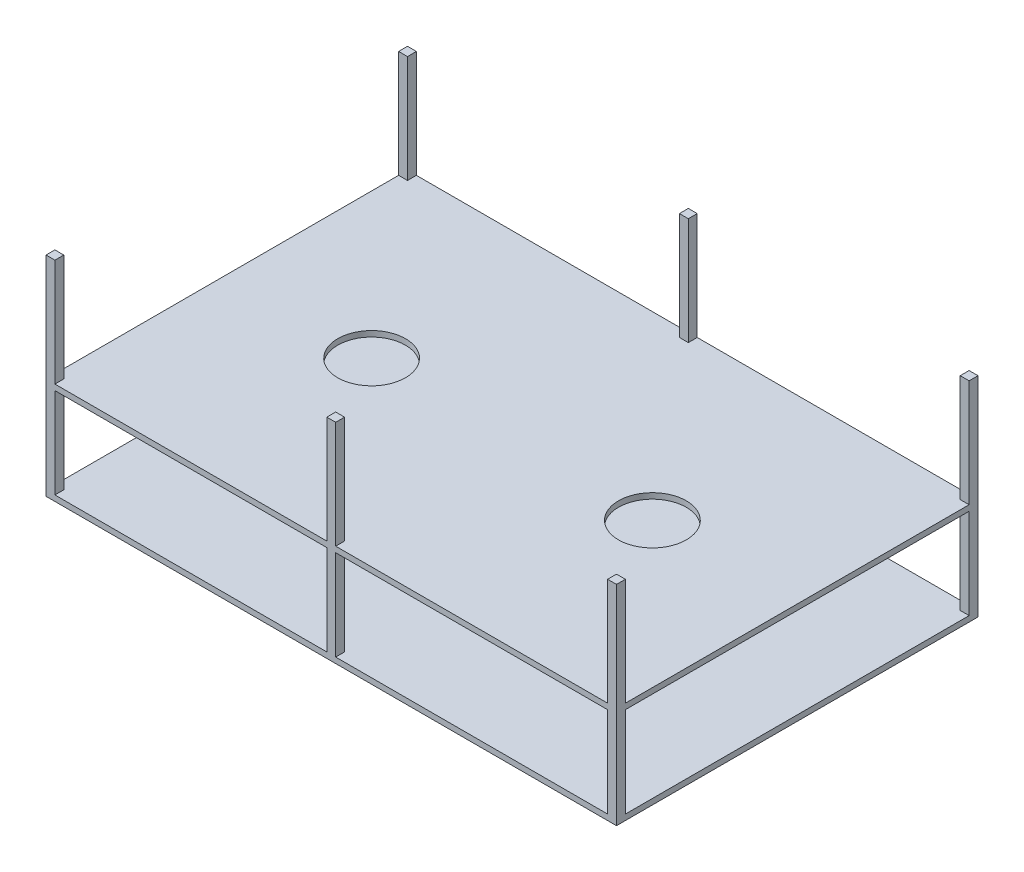
from build123d import *

# Parameters (mm, degrees)
SKETCH1_W             = 40
SKETCH1_H             = 40
BOSS_EXTRUDE1_DEPTH   = 939.8
BOSS_EXTRUDE1_2_DEPTH = 939.8
BOSS_EXTRUDE1_3_DEPTH = 939.8
BOSS_EXTRUDE1_4_DEPTH = 939.8
BOSS_EXTRUDE1_5_DEPTH = 939.8
BOSS_EXTRUDE1_6_DEPTH = 939.8
SKETCH2_W             = 2565.4
SKETCH2_H             = 1625.6
BOSS_EXTRUDE2_DEPTH   = 25.4
SKETCH3_W             = 2565.4
SKETCH3_H             = 1625.6
BOSS_EXTRUDE3_DEPTH   = 25.4
SKETCH4_R             = 152.4
CUT_EXTRUDE1_DEPTH    = 1606.227272334


with BuildPart() as part:
    # Sketch1 → Boss-Extrude1 (new body)
    with BuildSketch(Plane.XZ.offset(-2661.458218508)):
        with Locations((1253.466421536, 801.437438082)):
            Rectangle(SKETCH1_W, SKETCH1_H)
    extrude(amount=BOSS_EXTRUDE1_DEPTH)



with BuildPart() as body_2:
    # Sketch1 → Boss-Extrude1 2 (new body)
    with BuildSketch(Plane.XZ.offset(-2661.458218508)):
        with Locations((-1271.933578464, 801.437438082)):
            Rectangle(SKETCH1_W, SKETCH1_H)
    extrude(amount=BOSS_EXTRUDE1_2_DEPTH)


with BuildPart() as body_3:
    # Sketch1 → Boss-Extrude1 3 (new body)
    with BuildSketch(Plane.XZ.offset(-2661.458218508)):
        with Locations((-9.233578464, 801.437438082)):
            Rectangle(SKETCH1_W, SKETCH1_H)
    extrude(amount=BOSS_EXTRUDE1_3_DEPTH)


with BuildPart() as body_4:
    # Sketch1 → Boss-Extrude1 4 (new body)
    with BuildSketch(Plane.XZ.offset(-2661.458218508)):
        with Locations((-1271.933578464, -784.162561918)):
            Rectangle(SKETCH1_W, SKETCH1_H)
    extrude(amount=BOSS_EXTRUDE1_4_DEPTH)


with BuildPart() as body_5:
    # Sketch1 → Boss-Extrude1 5 (new body)
    with BuildSketch(Plane.XZ.offset(-2661.458218508)):
        with Locations((-9.233578464, -784.162561918)):
            Rectangle(SKETCH1_W, SKETCH1_H)
    extrude(amount=BOSS_EXTRUDE1_5_DEPTH)


with BuildPart() as body_6:
    # Sketch1 → Boss-Extrude1 6 (new body)
    with BuildSketch(Plane.XZ.offset(-2661.458218508)):
        with Locations((1253.466421536, -784.162561918)):
            Rectangle(SKETCH1_W, SKETCH1_H)
    extrude(amount=BOSS_EXTRUDE1_6_DEPTH)


with BuildPart() as part_1:
    add(part.part)

    add(body_2.part)  # Boss-Extrude2 merges body 2

    add(body_3.part)  # Boss-Extrude2 merges body 3

    add(body_4.part)  # Boss-Extrude2 merges body 4

    add(body_5.part)  # Boss-Extrude2 merges body 5

    add(body_6.part)  # Boss-Extrude2 merges body 6
    # Sketch2 → Boss-Extrude2 (add)
    with BuildSketch(Plane.XZ.offset(-1721.658218508)):
        with Locations((-9.233578464, 8.637438082)):
            Rectangle(SKETCH2_W, SKETCH2_H)
    extrude(amount=-BOSS_EXTRUDE2_DEPTH)

    # Sketch3 → Boss-Extrude3 (add)
    with BuildSketch(Plane.XZ.offset(-2153.458218508)):
        with Locations((-9.233578464, 8.637438082)):
            Rectangle(SKETCH3_W, SKETCH3_H)
    extrude(amount=-BOSS_EXTRUDE3_DEPTH)

    # Sketch4 → Cut-Extrude1 (cut, through all)
    with BuildSketch(Plane(origin=(0, 2178.858218508, 0), x_dir=(1, 0, 0), z_dir=(0, 1, 0))):
        with Locations((-640.583578464, -8.637438082)):
            Circle(SKETCH4_R)
        with Locations((622.116421536, -8.637438082)):
            Circle(SKETCH4_R)
    extrude(amount=-CUT_EXTRUDE1_DEPTH, mode=Mode.SUBTRACT)


solid = part_1.part
